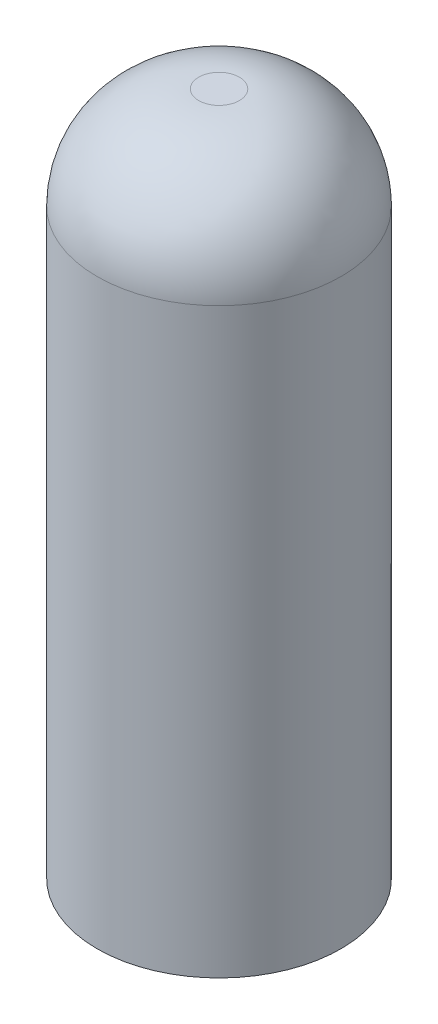
from build123d import *

# Parameters (mm, degrees)
SKETCH1_R           = 6
BOSS_EXTRUDE1_DEPTH = 33.65
FILLET2_R           = 5
SHELL1_OUTLINE_R    = 5
SHELL1_DEPTH        = 23.65
SCALE1_SCALE        = 2


# Read off the part's stored shape, not the designer's step: Shell1
with BuildPart() as part:
    # Sketch1 → Boss-Extrude1 (new body)
    with BuildSketch(Plane(origin=(0, 0, 0), x_dir=(1, 0, 0), z_dir=(0, 1, 0))):
        with Locations(Location((0, 0, 0), (0, 0, 270))):
            Circle(SKETCH1_R)
    extrude(amount=BOSS_EXTRUDE1_DEPTH)

    # Fillet2
    fillet2_edges = [part.edges().sort_by_distance(p)[0] for p in [
        (0, 33.65, -6),
    ]]
    fillet(fillet2_edges, radius=FILLET2_R)

    # Shell1 outline → Shell1 (cut)
    with BuildSketch(Plane(origin=(0, 0, 0), x_dir=(1, 0, 0), z_dir=(0, 1, 0))):
        Circle(SHELL1_OUTLINE_R)
    extrude(amount=SHELL1_DEPTH, mode=Mode.SUBTRACT)


with BuildPart() as part_1:
    # Scale1: scaled about (0, 20.592026778, 0)
    add(part.part.scale(SCALE1_SCALE).moved(Location((0, -20.592026778, 0))))


solid = part_1.part
